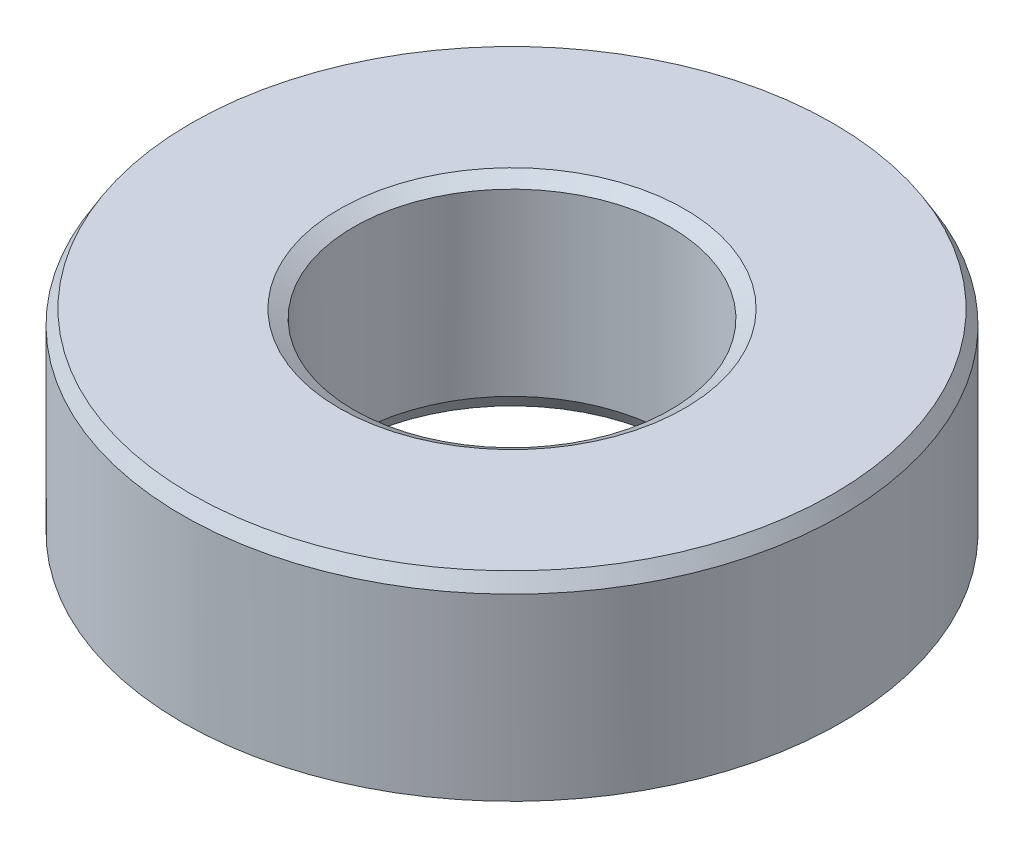
from build123d import *
from OCP.BRepFilletAPI import BRepFilletAPI_MakeChamfer

# Parameters (mm, degrees)
SKETCH1_R           = 40
BOSS_EXTRUDE1_DEPTH = 24.537373684
SKETCH2_R           = 19.222618888
CUT_EXTRUDE1_DEPTH  = 62.661030703
CHAMFER1_SIZE       = 1.730849463
CHAMFER1_SIZE2      = 1.026960594


with BuildPart() as part:
    # Sketch1 → Boss-Extrude1 (new body)
    with BuildSketch(Plane(origin=(0, 0, 0), x_dir=(1, 0, 0), z_dir=(0, 1, 0))):
        Circle(SKETCH1_R)
    extrude(amount=BOSS_EXTRUDE1_DEPTH)

    # Sketch2 → Cut-Extrude1 (cut, through all)
    with BuildSketch(Plane(origin=(0, 0, 0), x_dir=(1, 0, 0), z_dir=(0, 1, 0))):
        Circle(SKETCH2_R)
    extrude(amount=CUT_EXTRUDE1_DEPTH, mode=Mode.SUBTRACT)

    # Chamfer1: one chamfer whose edges measure the first distance from different faces: ONE call of the kernel's chamfer builder (chamfer() names one face for all edges)
    chamfer1_edges_1 = [part.edges().sort_by_distance(p)[0] for p in [
        (-19.222618888, 24.537373684, 0),
    ]]
    chamfer1_side_1 = [part.faces().sort_by_distance(p)[0] for p in [
        (-38.86862915, 24.537373684, 0),
    ]]
    chamfer1_edges_2 = [part.edges().sort_by_distance(p)[0] for p in [
        (-19.222618888, 0, 0),
    ]]
    chamfer1_side_2 = [part.faces().sort_by_distance(p)[0] for p in [
        (-19.222618888, 12.268686842, 0),
    ]]
    chamfer1_edges_3 = [part.edges().sort_by_distance(p)[0] for p in [
        (-40, 0, 0),
    ]]
    chamfer1_side_3 = [part.faces().sort_by_distance(p)[0] for p in [
        (-38.86862915, 0, 0),
    ]]
    chamfer1_edges_4 = [part.edges().sort_by_distance(p)[0] for p in [
        (-40, 24.537373684, 0),
    ]]
    chamfer1_side_4 = [part.faces().sort_by_distance(p)[0] for p in [
        (-40, 12.268686842, 0),
    ]]
    chamfer1 = BRepFilletAPI_MakeChamfer(part.part.solid().wrapped)
    for e in chamfer1_edges_1:
        chamfer1.Add(CHAMFER1_SIZE, CHAMFER1_SIZE2, e.wrapped, chamfer1_side_1[0].wrapped)  # the first distance lies on this face
    for e in chamfer1_edges_2:
        chamfer1.Add(CHAMFER1_SIZE, CHAMFER1_SIZE2, e.wrapped, chamfer1_side_2[0].wrapped)  # the first distance lies on this face
    for e in chamfer1_edges_3:
        chamfer1.Add(CHAMFER1_SIZE, CHAMFER1_SIZE2, e.wrapped, chamfer1_side_3[0].wrapped)  # the first distance lies on this face
    for e in chamfer1_edges_4:
        chamfer1.Add(CHAMFER1_SIZE, CHAMFER1_SIZE2, e.wrapped, chamfer1_side_4[0].wrapped)  # the first distance lies on this face
    add(Compound.cast(chamfer1.Shape()), mode=Mode.REPLACE)


solid = part.part
